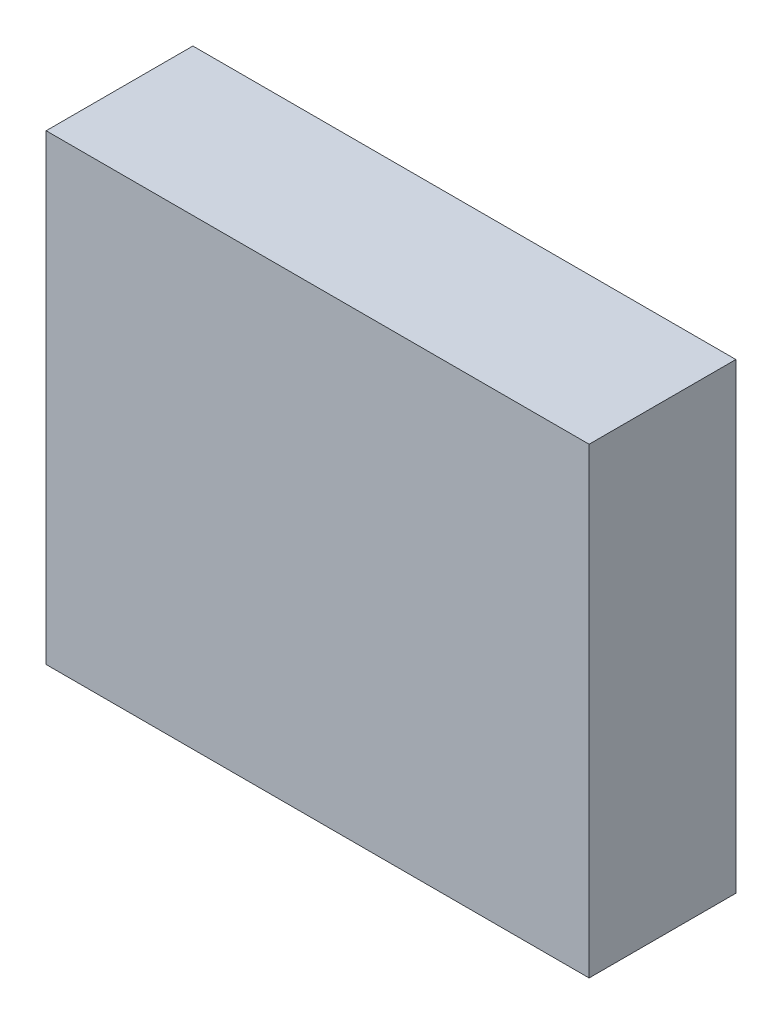
from build123d import *

# Parameters (mm, degrees)
SKETCH1_W            = 74
SKETCH1_H            = 63
MOLD_BASE_DEPTH      = 20
SKETCH2_W            = 64
SKETCH2_H            = 53
MOLD_CUT_DEPTH       = 10
LPATTERN1_COUNT      = 3
LPATTERN1_PITCH      = 10
LPATTERN1_COUNT_DIR2 = 3
LPATTERN1_PITCH_DIR2 = 10


with BuildPart() as part:
    # Sketch1 → Mold Base (new body)
    with BuildSketch(Plane.XY):
        Rectangle(SKETCH1_W, SKETCH1_H)
    extrude(amount=MOLD_BASE_DEPTH)

    # Sketch2 → Mold Cut (cut)
    with BuildSketch(Plane(origin=(0, 0, 0), x_dir=(-1, 0, 0), z_dir=(0, 0, -1))):
        Rectangle(SKETCH2_W, SKETCH2_H)
    extrude(amount=-MOLD_CUT_DEPTH, mode=Mode.SUBTRACT)

    # Sketch3 → Mold (revolve, cut)
    with BuildSketch(Plane(origin=(0, 0, 10), x_dir=(-1, 0, 0), z_dir=(0, 0, -1))):
        with BuildLine():
            Line((0, 2.5), (0, -2.5))
            ThreePointArc((0, -2.5), (2.5, 0), (0, 2.5))
        make_face()
    mold = revolve(axis=Axis((0, 2.5, 10), (0, -1, 0)), mode=Mode.SUBTRACT)

    # LPattern1: Mold 3 × 3
    with Locations(*[(-j * LPATTERN1_PITCH_DIR2, i * LPATTERN1_PITCH, 0) for i in range(LPATTERN1_COUNT) for j in range(LPATTERN1_COUNT_DIR2) if (i, j) != (0, 0)]):
        add(mold, mode=Mode.SUBTRACT)

    # LPattern2 copy 1 sketch → LPattern2 copy 1 (revolve, cut)
    with BuildSketch(Plane(origin=(-10, -10, 10), x_dir=(-1, 0, 0), z_dir=(0, 0, -1))):
        with BuildLine():
            Line((0, 2.5), (0, -2.5))
            ThreePointArc((0, -2.5), (2.5, 0), (0, 2.5))
        make_face()
    revolve(axis=Axis((-10, -7.5, 10), (0, -1, 0)), mode=Mode.SUBTRACT)

    # LPattern2 copy 2 sketch → LPattern2 copy 2 (revolve, cut)
    with BuildSketch(Plane(origin=(-10, -20, 10), x_dir=(-1, 0, 0), z_dir=(0, 0, -1))):
        with BuildLine():
            Line((0, 2.5), (0, -2.5))
            ThreePointArc((0, -2.5), (2.5, 0), (0, 2.5))
        make_face()
    revolve(axis=Axis((-10, -17.5, 10), (0, -1, 0)), mode=Mode.SUBTRACT)

    # LPattern2 copy 3 sketch → LPattern2 copy 3 (revolve, cut)
    with BuildSketch(Plane(origin=(0, 0, 10), x_dir=(-1, 0, 0), z_dir=(0, 0, -1))):
        with BuildLine():
            Line((0, 2.5), (0, -2.5))
            ThreePointArc((0, -2.5), (2.5, 0), (0, 2.5))
        make_face()
    revolve(axis=Axis((0, 2.5, 10), (0, -1, 0)), mode=Mode.SUBTRACT)

    # LPattern2 copy 4 sketch → LPattern2 copy 4 (revolve, cut)
    with BuildSketch(Plane(origin=(0, -10, 10), x_dir=(-1, 0, 0), z_dir=(0, 0, -1))):
        with BuildLine():
            Line((0, 2.5), (0, -2.5))
            ThreePointArc((0, -2.5), (2.5, 0), (0, 2.5))
        make_face()
    revolve(axis=Axis((0, -7.5, 10), (0, -1, 0)), mode=Mode.SUBTRACT)

    # LPattern2 copy 5 sketch → LPattern2 copy 5 (revolve, cut)
    with BuildSketch(Plane(origin=(0, -20, 10), x_dir=(-1, 0, 0), z_dir=(0, 0, -1))):
        with BuildLine():
            Line((0, 2.5), (0, -2.5))
            ThreePointArc((0, -2.5), (2.5, 0), (0, 2.5))
        make_face()
    revolve(axis=Axis((0, -17.5, 10), (0, -1, 0)), mode=Mode.SUBTRACT)

    # LPattern2 copy 6 sketch → LPattern2 copy 6 (revolve, cut)
    with BuildSketch(Plane(origin=(10, 0, 10), x_dir=(-1, 0, 0), z_dir=(0, 0, -1))):
        with BuildLine():
            Line((0, 2.5), (0, -2.5))
            ThreePointArc((0, -2.5), (2.5, 0), (0, 2.5))
        make_face()
    revolve(axis=Axis((10, 2.5, 10), (0, -1, 0)), mode=Mode.SUBTRACT)

    # LPattern2 copy 7 sketch → LPattern2 copy 7 (revolve, cut)
    with BuildSketch(Plane(origin=(10, -10, 10), x_dir=(-1, 0, 0), z_dir=(0, 0, -1))):
        with BuildLine():
            Line((0, 2.5), (0, -2.5))
            ThreePointArc((0, -2.5), (2.5, 0), (0, 2.5))
        make_face()
    revolve(axis=Axis((10, -7.5, 10), (0, -1, 0)), mode=Mode.SUBTRACT)

    # LPattern2 copy 8 sketch → LPattern2 copy 8 (revolve, cut)
    with BuildSketch(Plane(origin=(10, -20, 10), x_dir=(-1, 0, 0), z_dir=(0, 0, -1))):
        with BuildLine():
            Line((0, 2.5), (0, -2.5))
            ThreePointArc((0, -2.5), (2.5, 0), (0, 2.5))
        make_face()
    revolve(axis=Axis((10, -17.5, 10), (0, -1, 0)), mode=Mode.SUBTRACT)

    # LPattern2 copy 9 sketch → LPattern2 copy 9 (revolve, cut)
    with BuildSketch(Plane(origin=(-20, -10, 10), x_dir=(-1, 0, 0), z_dir=(0, 0, -1))):
        with BuildLine():
            Line((0, 2.5), (0, -2.5))
            ThreePointArc((0, -2.5), (2.5, 0), (0, 2.5))
        make_face()
    revolve(axis=Axis((-20, -7.5, 10), (0, -1, 0)), mode=Mode.SUBTRACT)

    # LPattern2 copy 10 sketch → LPattern2 copy 10 (revolve, cut)
    with BuildSketch(Plane(origin=(-20, -20, 10), x_dir=(-1, 0, 0), z_dir=(0, 0, -1))):
        with BuildLine():
            Line((0, 2.5), (0, -2.5))
            ThreePointArc((0, -2.5), (2.5, 0), (0, 2.5))
        make_face()
    revolve(axis=Axis((-20, -17.5, 10), (0, -1, 0)), mode=Mode.SUBTRACT)

    # LPattern2 copy 11 sketch → LPattern2 copy 11 (revolve, cut)
    with BuildSketch(Plane(origin=(-10, 0, 10), x_dir=(-1, 0, 0), z_dir=(0, 0, -1))):
        with BuildLine():
            Line((0, 2.5), (0, -2.5))
            ThreePointArc((0, -2.5), (2.5, 0), (0, 2.5))
        make_face()
    revolve(axis=Axis((-10, 2.5, 10), (0, -1, 0)), mode=Mode.SUBTRACT)

    # LPattern2 copy 12 sketch → LPattern2 copy 12 (revolve, cut)
    with BuildSketch(Plane(origin=(-10, -10, 10), x_dir=(-1, 0, 0), z_dir=(0, 0, -1))):
        with BuildLine():
            Line((0, 2.5), (0, -2.5))
            ThreePointArc((0, -2.5), (2.5, 0), (0, 2.5))
        make_face()
    revolve(axis=Axis((-10, -7.5, 10), (0, -1, 0)), mode=Mode.SUBTRACT)

    # LPattern2 copy 13 sketch → LPattern2 copy 13 (revolve, cut)
    with BuildSketch(Plane(origin=(-10, -20, 10), x_dir=(-1, 0, 0), z_dir=(0, 0, -1))):
        with BuildLine():
            Line((0, 2.5), (0, -2.5))
            ThreePointArc((0, -2.5), (2.5, 0), (0, 2.5))
        make_face()
    revolve(axis=Axis((-10, -17.5, 10), (0, -1, 0)), mode=Mode.SUBTRACT)

    # LPattern2 copy 14 sketch → LPattern2 copy 14 (revolve, cut)
    with BuildSketch(Plane(origin=(0, 0, 10), x_dir=(-1, 0, 0), z_dir=(0, 0, -1))):
        with BuildLine():
            Line((0, 2.5), (0, -2.5))
            ThreePointArc((0, -2.5), (2.5, 0), (0, 2.5))
        make_face()
    revolve(axis=Axis((0, 2.5, 10), (0, -1, 0)), mode=Mode.SUBTRACT)

    # LPattern2 copy 15 sketch → LPattern2 copy 15 (revolve, cut)
    with BuildSketch(Plane(origin=(0, -10, 10), x_dir=(-1, 0, 0), z_dir=(0, 0, -1))):
        with BuildLine():
            Line((0, 2.5), (0, -2.5))
            ThreePointArc((0, -2.5), (2.5, 0), (0, 2.5))
        make_face()
    revolve(axis=Axis((0, -7.5, 10), (0, -1, 0)), mode=Mode.SUBTRACT)

    # LPattern2 copy 16 sketch → LPattern2 copy 16 (revolve, cut)
    with BuildSketch(Plane(origin=(0, -20, 10), x_dir=(-1, 0, 0), z_dir=(0, 0, -1))):
        with BuildLine():
            Line((0, 2.5), (0, -2.5))
            ThreePointArc((0, -2.5), (2.5, 0), (0, 2.5))
        make_face()
    revolve(axis=Axis((0, -17.5, 10), (0, -1, 0)), mode=Mode.SUBTRACT)

    # LPattern2 copy 17 sketch → LPattern2 copy 17 (revolve, cut)
    with BuildSketch(Plane(origin=(0, 0, 10), x_dir=(-1, 0, 0), z_dir=(0, 0, -1))):
        with BuildLine():
            Line((0, 2.5), (0, -2.5))
            ThreePointArc((0, -2.5), (2.5, 0), (0, 2.5))
        make_face()
    revolve(axis=Axis((0, 2.5, 10), (0, -1, 0)), mode=Mode.SUBTRACT)

    # LPattern2 copy 18 sketch → LPattern2 copy 18 (revolve, cut)
    with BuildSketch(Plane(origin=(0, -10, 10), x_dir=(-1, 0, 0), z_dir=(0, 0, -1))):
        with BuildLine():
            Line((0, 2.5), (0, -2.5))
            ThreePointArc((0, -2.5), (2.5, 0), (0, 2.5))
        make_face()
    revolve(axis=Axis((0, -7.5, 10), (0, -1, 0)), mode=Mode.SUBTRACT)

    # LPattern2 copy 19 sketch → LPattern2 copy 19 (revolve, cut)
    with BuildSketch(Plane(origin=(10, 10, 10), x_dir=(-1, 0, 0), z_dir=(0, 0, -1))):
        with BuildLine():
            Line((0, 2.5), (0, -2.5))
            ThreePointArc((0, -2.5), (2.5, 0), (0, 2.5))
        make_face()
    revolve(axis=Axis((10, 12.5, 10), (0, -1, 0)), mode=Mode.SUBTRACT)

    # LPattern2 copy 20 sketch → LPattern2 copy 20 (revolve, cut)
    with BuildSketch(Plane(origin=(10, 0, 10), x_dir=(-1, 0, 0), z_dir=(0, 0, -1))):
        with BuildLine():
            Line((0, 2.5), (0, -2.5))
            ThreePointArc((0, -2.5), (2.5, 0), (0, 2.5))
        make_face()
    revolve(axis=Axis((10, 2.5, 10), (0, -1, 0)), mode=Mode.SUBTRACT)

    # LPattern2 copy 21 sketch → LPattern2 copy 21 (revolve, cut)
    with BuildSketch(Plane(origin=(10, -10, 10), x_dir=(-1, 0, 0), z_dir=(0, 0, -1))):
        with BuildLine():
            Line((0, 2.5), (0, -2.5))
            ThreePointArc((0, -2.5), (2.5, 0), (0, 2.5))
        make_face()
    revolve(axis=Axis((10, -7.5, 10), (0, -1, 0)), mode=Mode.SUBTRACT)

    # LPattern2 copy 22 sketch → LPattern2 copy 22 (revolve, cut)
    with BuildSketch(Plane(origin=(20, 10, 10), x_dir=(-1, 0, 0), z_dir=(0, 0, -1))):
        with BuildLine():
            Line((0, 2.5), (0, -2.5))
            ThreePointArc((0, -2.5), (2.5, 0), (0, 2.5))
        make_face()
    revolve(axis=Axis((20, 12.5, 10), (0, -1, 0)), mode=Mode.SUBTRACT)

    # LPattern2 copy 23 sketch → LPattern2 copy 23 (revolve, cut)
    with BuildSketch(Plane(origin=(20, 0, 10), x_dir=(-1, 0, 0), z_dir=(0, 0, -1))):
        with BuildLine():
            Line((0, 2.5), (0, -2.5))
            ThreePointArc((0, -2.5), (2.5, 0), (0, 2.5))
        make_face()
    revolve(axis=Axis((20, 2.5, 10), (0, -1, 0)), mode=Mode.SUBTRACT)

    # LPattern2 copy 24 sketch → LPattern2 copy 24 (revolve, cut)
    with BuildSketch(Plane(origin=(20, -10, 10), x_dir=(-1, 0, 0), z_dir=(0, 0, -1))):
        with BuildLine():
            Line((0, 2.5), (0, -2.5))
            ThreePointArc((0, -2.5), (2.5, 0), (0, 2.5))
        make_face()
    revolve(axis=Axis((20, -7.5, 10), (0, -1, 0)), mode=Mode.SUBTRACT)

    # LPattern2 copy 25 sketch → LPattern2 copy 25 (revolve, cut)
    with BuildSketch(Plane(origin=(-10, 0, 10), x_dir=(-1, 0, 0), z_dir=(0, 0, -1))):
        with BuildLine():
            Line((0, 2.5), (0, -2.5))
            ThreePointArc((0, -2.5), (2.5, 0), (0, 2.5))
        make_face()
    revolve(axis=Axis((-10, 2.5, 10), (0, -1, 0)), mode=Mode.SUBTRACT)

    # LPattern2 copy 26 sketch → LPattern2 copy 26 (revolve, cut)
    with BuildSketch(Plane(origin=(-10, -10, 10), x_dir=(-1, 0, 0), z_dir=(0, 0, -1))):
        with BuildLine():
            Line((0, 2.5), (0, -2.5))
            ThreePointArc((0, -2.5), (2.5, 0), (0, 2.5))
        make_face()
    revolve(axis=Axis((-10, -7.5, 10), (0, -1, 0)), mode=Mode.SUBTRACT)

    # LPattern2 copy 27 sketch → LPattern2 copy 27 (revolve, cut)
    with BuildSketch(Plane(origin=(0, 10, 10), x_dir=(-1, 0, 0), z_dir=(0, 0, -1))):
        with BuildLine():
            Line((0, 2.5), (0, -2.5))
            ThreePointArc((0, -2.5), (2.5, 0), (0, 2.5))
        make_face()
    revolve(axis=Axis((0, 12.5, 10), (0, -1, 0)), mode=Mode.SUBTRACT)

    # LPattern2 copy 28 sketch → LPattern2 copy 28 (revolve, cut)
    with BuildSketch(Plane(origin=(0, 0, 10), x_dir=(-1, 0, 0), z_dir=(0, 0, -1))):
        with BuildLine():
            Line((0, 2.5), (0, -2.5))
            ThreePointArc((0, -2.5), (2.5, 0), (0, 2.5))
        make_face()
    revolve(axis=Axis((0, 2.5, 10), (0, -1, 0)), mode=Mode.SUBTRACT)

    # LPattern2 copy 29 sketch → LPattern2 copy 29 (revolve, cut)
    with BuildSketch(Plane(origin=(0, -10, 10), x_dir=(-1, 0, 0), z_dir=(0, 0, -1))):
        with BuildLine():
            Line((0, 2.5), (0, -2.5))
            ThreePointArc((0, -2.5), (2.5, 0), (0, 2.5))
        make_face()
    revolve(axis=Axis((0, -7.5, 10), (0, -1, 0)), mode=Mode.SUBTRACT)

    # LPattern2 copy 30 sketch → LPattern2 copy 30 (revolve, cut)
    with BuildSketch(Plane(origin=(10, 10, 10), x_dir=(-1, 0, 0), z_dir=(0, 0, -1))):
        with BuildLine():
            Line((0, 2.5), (0, -2.5))
            ThreePointArc((0, -2.5), (2.5, 0), (0, 2.5))
        make_face()
    revolve(axis=Axis((10, 12.5, 10), (0, -1, 0)), mode=Mode.SUBTRACT)

    # LPattern2 copy 31 sketch → LPattern2 copy 31 (revolve, cut)
    with BuildSketch(Plane(origin=(10, 0, 10), x_dir=(-1, 0, 0), z_dir=(0, 0, -1))):
        with BuildLine():
            Line((0, 2.5), (0, -2.5))
            ThreePointArc((0, -2.5), (2.5, 0), (0, 2.5))
        make_face()
    revolve(axis=Axis((10, 2.5, 10), (0, -1, 0)), mode=Mode.SUBTRACT)

    # LPattern2 copy 32 sketch → LPattern2 copy 32 (revolve, cut)
    with BuildSketch(Plane(origin=(10, -10, 10), x_dir=(-1, 0, 0), z_dir=(0, 0, -1))):
        with BuildLine():
            Line((0, 2.5), (0, -2.5))
            ThreePointArc((0, -2.5), (2.5, 0), (0, 2.5))
        make_face()
    revolve(axis=Axis((10, -7.5, 10), (0, -1, 0)), mode=Mode.SUBTRACT)

    # LPattern2 copy 33 sketch → LPattern2 copy 33 (revolve, cut)
    with BuildSketch(Plane(origin=(-20, 0, 10), x_dir=(-1, 0, 0), z_dir=(0, 0, -1))):
        with BuildLine():
            Line((0, 2.5), (0, -2.5))
            ThreePointArc((0, -2.5), (2.5, 0), (0, 2.5))
        make_face()
    revolve(axis=Axis((-20, 2.5, 10), (0, -1, 0)), mode=Mode.SUBTRACT)

    # LPattern2 copy 34 sketch → LPattern2 copy 34 (revolve, cut)
    with BuildSketch(Plane(origin=(-20, -10, 10), x_dir=(-1, 0, 0), z_dir=(0, 0, -1))):
        with BuildLine():
            Line((0, 2.5), (0, -2.5))
            ThreePointArc((0, -2.5), (2.5, 0), (0, 2.5))
        make_face()
    revolve(axis=Axis((-20, -7.5, 10), (0, -1, 0)), mode=Mode.SUBTRACT)

    # LPattern2 copy 35 sketch → LPattern2 copy 35 (revolve, cut)
    with BuildSketch(Plane(origin=(-10, 10, 10), x_dir=(-1, 0, 0), z_dir=(0, 0, -1))):
        with BuildLine():
            Line((0, 2.5), (0, -2.5))
            ThreePointArc((0, -2.5), (2.5, 0), (0, 2.5))
        make_face()
    revolve(axis=Axis((-10, 12.5, 10), (0, -1, 0)), mode=Mode.SUBTRACT)

    # LPattern2 copy 36 sketch → LPattern2 copy 36 (revolve, cut)
    with BuildSketch(Plane(origin=(-10, 0, 10), x_dir=(-1, 0, 0), z_dir=(0, 0, -1))):
        with BuildLine():
            Line((0, 2.5), (0, -2.5))
            ThreePointArc((0, -2.5), (2.5, 0), (0, 2.5))
        make_face()
    revolve(axis=Axis((-10, 2.5, 10), (0, -1, 0)), mode=Mode.SUBTRACT)

    # LPattern2 copy 37 sketch → LPattern2 copy 37 (revolve, cut)
    with BuildSketch(Plane(origin=(-10, -10, 10), x_dir=(-1, 0, 0), z_dir=(0, 0, -1))):
        with BuildLine():
            Line((0, 2.5), (0, -2.5))
            ThreePointArc((0, -2.5), (2.5, 0), (0, 2.5))
        make_face()
    revolve(axis=Axis((-10, -7.5, 10), (0, -1, 0)), mode=Mode.SUBTRACT)

    # LPattern2 copy 38 sketch → LPattern2 copy 38 (revolve, cut)
    with BuildSketch(Plane(origin=(0, 10, 10), x_dir=(-1, 0, 0), z_dir=(0, 0, -1))):
        with BuildLine():
            Line((0, 2.5), (0, -2.5))
            ThreePointArc((0, -2.5), (2.5, 0), (0, 2.5))
        make_face()
    revolve(axis=Axis((0, 12.5, 10), (0, -1, 0)), mode=Mode.SUBTRACT)

    # LPattern2 copy 39 sketch → LPattern2 copy 39 (revolve, cut)
    with BuildSketch(Plane(origin=(0, 0, 10), x_dir=(-1, 0, 0), z_dir=(0, 0, -1))):
        with BuildLine():
            Line((0, 2.5), (0, -2.5))
            ThreePointArc((0, -2.5), (2.5, 0), (0, 2.5))
        make_face()
    revolve(axis=Axis((0, 2.5, 10), (0, -1, 0)), mode=Mode.SUBTRACT)

    # LPattern2 copy 40 sketch → LPattern2 copy 40 (revolve, cut)
    with BuildSketch(Plane(origin=(0, -10, 10), x_dir=(-1, 0, 0), z_dir=(0, 0, -1))):
        with BuildLine():
            Line((0, 2.5), (0, -2.5))
            ThreePointArc((0, -2.5), (2.5, 0), (0, 2.5))
        make_face()
    revolve(axis=Axis((0, -7.5, 10), (0, -1, 0)), mode=Mode.SUBTRACT)

    # LPattern2 copy 41 sketch → LPattern2 copy 41 (revolve, cut)
    with BuildSketch(Plane(origin=(0, 10, 10), x_dir=(-1, 0, 0), z_dir=(0, 0, -1))):
        with BuildLine():
            Line((0, 2.5), (0, -2.5))
            ThreePointArc((0, -2.5), (2.5, 0), (0, 2.5))
        make_face()
    revolve(axis=Axis((0, 12.5, 10), (0, -1, 0)), mode=Mode.SUBTRACT)

    # LPattern2 copy 42 sketch → LPattern2 copy 42 (revolve, cut)
    with BuildSketch(Plane(origin=(0, 0, 10), x_dir=(-1, 0, 0), z_dir=(0, 0, -1))):
        with BuildLine():
            Line((0, 2.5), (0, -2.5))
            ThreePointArc((0, -2.5), (2.5, 0), (0, 2.5))
        make_face()
    revolve(axis=Axis((0, 2.5, 10), (0, -1, 0)), mode=Mode.SUBTRACT)

    # LPattern2 copy 43 sketch → LPattern2 copy 43 (revolve, cut)
    with BuildSketch(Plane(origin=(10, 20, 10), x_dir=(-1, 0, 0), z_dir=(0, 0, -1))):
        with BuildLine():
            Line((0, 2.5), (0, -2.5))
            ThreePointArc((0, -2.5), (2.5, 0), (0, 2.5))
        make_face()
    revolve(axis=Axis((10, 22.5, 10), (0, -1, 0)), mode=Mode.SUBTRACT)

    # LPattern2 copy 44 sketch → LPattern2 copy 44 (revolve, cut)
    with BuildSketch(Plane(origin=(10, 10, 10), x_dir=(-1, 0, 0), z_dir=(0, 0, -1))):
        with BuildLine():
            Line((0, 2.5), (0, -2.5))
            ThreePointArc((0, -2.5), (2.5, 0), (0, 2.5))
        make_face()
    revolve(axis=Axis((10, 12.5, 10), (0, -1, 0)), mode=Mode.SUBTRACT)

    # LPattern2 copy 45 sketch → LPattern2 copy 45 (revolve, cut)
    with BuildSketch(Plane(origin=(10, 0, 10), x_dir=(-1, 0, 0), z_dir=(0, 0, -1))):
        with BuildLine():
            Line((0, 2.5), (0, -2.5))
            ThreePointArc((0, -2.5), (2.5, 0), (0, 2.5))
        make_face()
    revolve(axis=Axis((10, 2.5, 10), (0, -1, 0)), mode=Mode.SUBTRACT)

    # LPattern2 copy 46 sketch → LPattern2 copy 46 (revolve, cut)
    with BuildSketch(Plane(origin=(20, 20, 10), x_dir=(-1, 0, 0), z_dir=(0, 0, -1))):
        with BuildLine():
            Line((0, 2.5), (0, -2.5))
            ThreePointArc((0, -2.5), (2.5, 0), (0, 2.5))
        make_face()
    revolve(axis=Axis((20, 22.5, 10), (0, -1, 0)), mode=Mode.SUBTRACT)

    # LPattern2 copy 47 sketch → LPattern2 copy 47 (revolve, cut)
    with BuildSketch(Plane(origin=(20, 10, 10), x_dir=(-1, 0, 0), z_dir=(0, 0, -1))):
        with BuildLine():
            Line((0, 2.5), (0, -2.5))
            ThreePointArc((0, -2.5), (2.5, 0), (0, 2.5))
        make_face()
    revolve(axis=Axis((20, 12.5, 10), (0, -1, 0)), mode=Mode.SUBTRACT)

    # LPattern2 copy 48 sketch → LPattern2 copy 48 (revolve, cut)
    with BuildSketch(Plane(origin=(20, 0, 10), x_dir=(-1, 0, 0), z_dir=(0, 0, -1))):
        with BuildLine():
            Line((0, 2.5), (0, -2.5))
            ThreePointArc((0, -2.5), (2.5, 0), (0, 2.5))
        make_face()
    revolve(axis=Axis((20, 2.5, 10), (0, -1, 0)), mode=Mode.SUBTRACT)

    # LPattern2 copy 49 sketch → LPattern2 copy 49 (revolve, cut)
    with BuildSketch(Plane(origin=(-10, 10, 10), x_dir=(-1, 0, 0), z_dir=(0, 0, -1))):
        with BuildLine():
            Line((0, 2.5), (0, -2.5))
            ThreePointArc((0, -2.5), (2.5, 0), (0, 2.5))
        make_face()
    revolve(axis=Axis((-10, 12.5, 10), (0, -1, 0)), mode=Mode.SUBTRACT)

    # LPattern2 copy 50 sketch → LPattern2 copy 50 (revolve, cut)
    with BuildSketch(Plane(origin=(-10, 0, 10), x_dir=(-1, 0, 0), z_dir=(0, 0, -1))):
        with BuildLine():
            Line((0, 2.5), (0, -2.5))
            ThreePointArc((0, -2.5), (2.5, 0), (0, 2.5))
        make_face()
    revolve(axis=Axis((-10, 2.5, 10), (0, -1, 0)), mode=Mode.SUBTRACT)

    # LPattern2 copy 51 sketch → LPattern2 copy 51 (revolve, cut)
    with BuildSketch(Plane(origin=(0, 20, 10), x_dir=(-1, 0, 0), z_dir=(0, 0, -1))):
        with BuildLine():
            Line((0, 2.5), (0, -2.5))
            ThreePointArc((0, -2.5), (2.5, 0), (0, 2.5))
        make_face()
    revolve(axis=Axis((0, 22.5, 10), (0, -1, 0)), mode=Mode.SUBTRACT)

    # LPattern2 copy 52 sketch → LPattern2 copy 52 (revolve, cut)
    with BuildSketch(Plane(origin=(0, 10, 10), x_dir=(-1, 0, 0), z_dir=(0, 0, -1))):
        with BuildLine():
            Line((0, 2.5), (0, -2.5))
            ThreePointArc((0, -2.5), (2.5, 0), (0, 2.5))
        make_face()
    revolve(axis=Axis((0, 12.5, 10), (0, -1, 0)), mode=Mode.SUBTRACT)

    # LPattern2 copy 53 sketch → LPattern2 copy 53 (revolve, cut)
    with BuildSketch(Plane(origin=(0, 0, 10), x_dir=(-1, 0, 0), z_dir=(0, 0, -1))):
        with BuildLine():
            Line((0, 2.5), (0, -2.5))
            ThreePointArc((0, -2.5), (2.5, 0), (0, 2.5))
        make_face()
    revolve(axis=Axis((0, 2.5, 10), (0, -1, 0)), mode=Mode.SUBTRACT)

    # LPattern2 copy 54 sketch → LPattern2 copy 54 (revolve, cut)
    with BuildSketch(Plane(origin=(10, 20, 10), x_dir=(-1, 0, 0), z_dir=(0, 0, -1))):
        with BuildLine():
            Line((0, 2.5), (0, -2.5))
            ThreePointArc((0, -2.5), (2.5, 0), (0, 2.5))
        make_face()
    revolve(axis=Axis((10, 22.5, 10), (0, -1, 0)), mode=Mode.SUBTRACT)

    # LPattern2 copy 55 sketch → LPattern2 copy 55 (revolve, cut)
    with BuildSketch(Plane(origin=(10, 10, 10), x_dir=(-1, 0, 0), z_dir=(0, 0, -1))):
        with BuildLine():
            Line((0, 2.5), (0, -2.5))
            ThreePointArc((0, -2.5), (2.5, 0), (0, 2.5))
        make_face()
    revolve(axis=Axis((10, 12.5, 10), (0, -1, 0)), mode=Mode.SUBTRACT)

    # LPattern2 copy 56 sketch → LPattern2 copy 56 (revolve, cut)
    with BuildSketch(Plane(origin=(10, 0, 10), x_dir=(-1, 0, 0), z_dir=(0, 0, -1))):
        with BuildLine():
            Line((0, 2.5), (0, -2.5))
            ThreePointArc((0, -2.5), (2.5, 0), (0, 2.5))
        make_face()
    revolve(axis=Axis((10, 2.5, 10), (0, -1, 0)), mode=Mode.SUBTRACT)

    # LPattern2 copy 57 sketch → LPattern2 copy 57 (revolve, cut)
    with BuildSketch(Plane(origin=(-20, 10, 10), x_dir=(-1, 0, 0), z_dir=(0, 0, -1))):
        with BuildLine():
            Line((0, 2.5), (0, -2.5))
            ThreePointArc((0, -2.5), (2.5, 0), (0, 2.5))
        make_face()
    revolve(axis=Axis((-20, 12.5, 10), (0, -1, 0)), mode=Mode.SUBTRACT)

    # LPattern2 copy 58 sketch → LPattern2 copy 58 (revolve, cut)
    with BuildSketch(Plane(origin=(-20, 0, 10), x_dir=(-1, 0, 0), z_dir=(0, 0, -1))):
        with BuildLine():
            Line((0, 2.5), (0, -2.5))
            ThreePointArc((0, -2.5), (2.5, 0), (0, 2.5))
        make_face()
    revolve(axis=Axis((-20, 2.5, 10), (0, -1, 0)), mode=Mode.SUBTRACT)

    # LPattern2 copy 59 sketch → LPattern2 copy 59 (revolve, cut)
    with BuildSketch(Plane(origin=(-10, 20, 10), x_dir=(-1, 0, 0), z_dir=(0, 0, -1))):
        with BuildLine():
            Line((0, 2.5), (0, -2.5))
            ThreePointArc((0, -2.5), (2.5, 0), (0, 2.5))
        make_face()
    revolve(axis=Axis((-10, 22.5, 10), (0, -1, 0)), mode=Mode.SUBTRACT)

    # LPattern2 copy 60 sketch → LPattern2 copy 60 (revolve, cut)
    with BuildSketch(Plane(origin=(-10, 10, 10), x_dir=(-1, 0, 0), z_dir=(0, 0, -1))):
        with BuildLine():
            Line((0, 2.5), (0, -2.5))
            ThreePointArc((0, -2.5), (2.5, 0), (0, 2.5))
        make_face()
    revolve(axis=Axis((-10, 12.5, 10), (0, -1, 0)), mode=Mode.SUBTRACT)

    # LPattern2 copy 61 sketch → LPattern2 copy 61 (revolve, cut)
    with BuildSketch(Plane(origin=(-10, 0, 10), x_dir=(-1, 0, 0), z_dir=(0, 0, -1))):
        with BuildLine():
            Line((0, 2.5), (0, -2.5))
            ThreePointArc((0, -2.5), (2.5, 0), (0, 2.5))
        make_face()
    revolve(axis=Axis((-10, 2.5, 10), (0, -1, 0)), mode=Mode.SUBTRACT)

    # LPattern2 copy 62 sketch → LPattern2 copy 62 (revolve, cut)
    with BuildSketch(Plane(origin=(0, 20, 10), x_dir=(-1, 0, 0), z_dir=(0, 0, -1))):
        with BuildLine():
            Line((0, 2.5), (0, -2.5))
            ThreePointArc((0, -2.5), (2.5, 0), (0, 2.5))
        make_face()
    revolve(axis=Axis((0, 22.5, 10), (0, -1, 0)), mode=Mode.SUBTRACT)

    # LPattern2 copy 63 sketch → LPattern2 copy 63 (revolve, cut)
    with BuildSketch(Plane(origin=(0, 10, 10), x_dir=(-1, 0, 0), z_dir=(0, 0, -1))):
        with BuildLine():
            Line((0, 2.5), (0, -2.5))
            ThreePointArc((0, -2.5), (2.5, 0), (0, 2.5))
        make_face()
    revolve(axis=Axis((0, 12.5, 10), (0, -1, 0)), mode=Mode.SUBTRACT)

    # LPattern2 copy 64 sketch → LPattern2 copy 64 (revolve, cut)
    with BuildSketch(Plane(origin=(0, 0, 10), x_dir=(-1, 0, 0), z_dir=(0, 0, -1))):
        with BuildLine():
            Line((0, 2.5), (0, -2.5))
            ThreePointArc((0, -2.5), (2.5, 0), (0, 2.5))
        make_face()
    revolve(axis=Axis((0, 2.5, 10), (0, -1, 0)), mode=Mode.SUBTRACT)

    # LPattern2 copy 65 sketch → LPattern2 copy 65 (revolve, cut)
    with BuildSketch(Plane(origin=(0, -10, 10), x_dir=(-1, 0, 0), z_dir=(0, 0, -1))):
        with BuildLine():
            Line((0, 2.5), (0, -2.5))
            ThreePointArc((0, -2.5), (2.5, 0), (0, 2.5))
        make_face()
    revolve(axis=Axis((0, -7.5, 10), (0, -1, 0)), mode=Mode.SUBTRACT)

    # LPattern2 copy 66 sketch → LPattern2 copy 66 (revolve, cut)
    with BuildSketch(Plane(origin=(0, -20, 10), x_dir=(-1, 0, 0), z_dir=(0, 0, -1))):
        with BuildLine():
            Line((0, 2.5), (0, -2.5))
            ThreePointArc((0, -2.5), (2.5, 0), (0, 2.5))
        make_face()
    revolve(axis=Axis((0, -17.5, 10), (0, -1, 0)), mode=Mode.SUBTRACT)

    # LPattern2 copy 67 sketch → LPattern2 copy 67 (revolve, cut)
    with BuildSketch(Plane(origin=(10, 0, 10), x_dir=(-1, 0, 0), z_dir=(0, 0, -1))):
        with BuildLine():
            Line((0, 2.5), (0, -2.5))
            ThreePointArc((0, -2.5), (2.5, 0), (0, 2.5))
        make_face()
    revolve(axis=Axis((10, 2.5, 10), (0, -1, 0)), mode=Mode.SUBTRACT)

    # LPattern2 copy 68 sketch → LPattern2 copy 68 (revolve, cut)
    with BuildSketch(Plane(origin=(10, -10, 10), x_dir=(-1, 0, 0), z_dir=(0, 0, -1))):
        with BuildLine():
            Line((0, 2.5), (0, -2.5))
            ThreePointArc((0, -2.5), (2.5, 0), (0, 2.5))
        make_face()
    revolve(axis=Axis((10, -7.5, 10), (0, -1, 0)), mode=Mode.SUBTRACT)

    # LPattern2 copy 69 sketch → LPattern2 copy 69 (revolve, cut)
    with BuildSketch(Plane(origin=(10, -20, 10), x_dir=(-1, 0, 0), z_dir=(0, 0, -1))):
        with BuildLine():
            Line((0, 2.5), (0, -2.5))
            ThreePointArc((0, -2.5), (2.5, 0), (0, 2.5))
        make_face()
    revolve(axis=Axis((10, -17.5, 10), (0, -1, 0)), mode=Mode.SUBTRACT)

    # LPattern2 copy 70 sketch → LPattern2 copy 70 (revolve, cut)
    with BuildSketch(Plane(origin=(20, 0, 10), x_dir=(-1, 0, 0), z_dir=(0, 0, -1))):
        with BuildLine():
            Line((0, 2.5), (0, -2.5))
            ThreePointArc((0, -2.5), (2.5, 0), (0, 2.5))
        make_face()
    revolve(axis=Axis((20, 2.5, 10), (0, -1, 0)), mode=Mode.SUBTRACT)

    # LPattern2 copy 71 sketch → LPattern2 copy 71 (revolve, cut)
    with BuildSketch(Plane(origin=(20, -10, 10), x_dir=(-1, 0, 0), z_dir=(0, 0, -1))):
        with BuildLine():
            Line((0, 2.5), (0, -2.5))
            ThreePointArc((0, -2.5), (2.5, 0), (0, 2.5))
        make_face()
    revolve(axis=Axis((20, -7.5, 10), (0, -1, 0)), mode=Mode.SUBTRACT)

    # LPattern2 copy 72 sketch → LPattern2 copy 72 (revolve, cut)
    with BuildSketch(Plane(origin=(20, -20, 10), x_dir=(-1, 0, 0), z_dir=(0, 0, -1))):
        with BuildLine():
            Line((0, 2.5), (0, -2.5))
            ThreePointArc((0, -2.5), (2.5, 0), (0, 2.5))
        make_face()
    revolve(axis=Axis((20, -17.5, 10), (0, -1, 0)), mode=Mode.SUBTRACT)


solid = part.part
